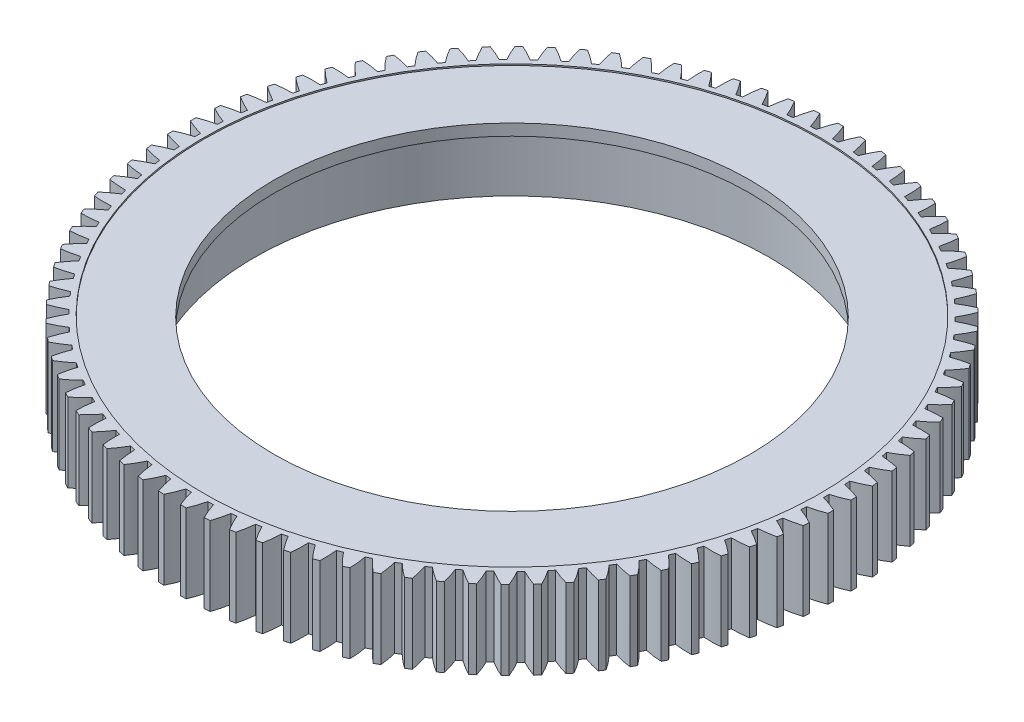
from build123d import *

# Parameters (mm, degrees)
SKETCH5_W           = 227.695
SKETCH5_H           = 54
HOLE1_D             = 332
HOLE1_CBORE_D       = 360
HOLE1_CBORE_DEPTH   = 46
SKETCH24_R          = 230
SKETCH24_R_2        = 215.126530268
BOSS_EXTRUDE1_DEPTH = 55
CUT_EXTRUDE2_DEPTH  = 330.886344064
CIRPATTERN1_COUNT   = 90


with BuildPart() as part:
    # Sketch5 → Revolve1 (revolve)
    with BuildSketch(Plane(origin=(0, 0, 0), x_dir=(-1, 0, 0), z_dir=(0, 0, -1))):
        with Locations((-113.8475, -27)):
            Rectangle(SKETCH5_W, SKETCH5_H)
    revolve(axis=Axis((0, -54, 0), (0, 1, 0)))

    # Sketch6 → Cut-Revolve1 (revolve, cut)
    with BuildSketch(Plane(origin=(0, 0, 137.885822331), x_dir=(-1, 0, 0), z_dir=(0, 0, -1))):
        Polygon((-141.209322331, -54), (-137.885822331, -54), (-137.885822331, -36), (-141.209322331, -37.996960267), (-141.209322331, -42), align=None)
    revolve(axis=Axis((137.885822331, -54, 137.885822331), (0, 1, 0)), mode=Mode.SUBTRACT)

    # Sketch7 → Cut-Revolve2 (revolve, cut)
    with BuildSketch(Plane(origin=(0, 0, 50.469713795), x_dir=(-1, 0, 0), z_dir=(0, 0, -1))):
        Polygon((-191.679036126, -54), (-188.355536126, -54), (-188.355536126, -36), (-191.679036126, -37.996960267), (-191.679036126, -42), align=None)
    revolve(axis=Axis((188.355536126, -54, 50.469713795), (0, 1, 0)), mode=Mode.SUBTRACT)

    # Sketch8 → Cut-Revolve3 (revolve, cut)
    with BuildSketch(Plane(origin=(0, 0, -50.469713795), x_dir=(-1, 0, 0), z_dir=(0, 0, -1))):
        Polygon((-191.679036126, -54), (-188.355536126, -54), (-188.355536126, -36), (-191.679036126, -37.996960267), (-191.679036126, -42), align=None)
    revolve(axis=Axis((188.355536126, -54, -50.469713795), (0, 1, 0)), mode=Mode.SUBTRACT)

    # Sketch9 → Cut-Revolve4 (revolve, cut)
    with BuildSketch(Plane(origin=(0, 0, -137.885822331), x_dir=(-1, 0, 0), z_dir=(0, 0, -1))):
        Polygon((-141.209322331, -54), (-137.885822331, -54), (-137.885822331, -36), (-141.209322331, -37.996960267), (-141.209322331, -42), align=None)
    revolve(axis=Axis((137.885822331, -54, -137.885822331), (0, 1, 0)), mode=Mode.SUBTRACT)

    # Sketch10 → Cut-Revolve5 (revolve, cut)
    with BuildSketch(Plane(origin=(0, 0, -188.355536126), x_dir=(-1, 0, 0), z_dir=(0, 0, -1))):
        Polygon((-53.793213795, -54), (-50.469713795, -54), (-50.469713795, -36), (-53.793213795, -37.996960267), (-53.793213795, -42), align=None)
    revolve(axis=Axis((50.469713795, -54, -188.355536126), (0, 1, 0)), mode=Mode.SUBTRACT)

    # Sketch11 → Cut-Revolve6 (revolve, cut)
    with BuildSketch(Plane(origin=(0, 0, -188.355536126), x_dir=(-1, 0, 0), z_dir=(0, 0, -1))):
        Polygon((47.146213795, -54), (50.469713795, -54), (50.469713795, -36), (47.146213795, -37.996960267), (47.146213795, -42), align=None)
    revolve(axis=Axis((-50.469713795, -54, -188.355536126), (0, 1, 0)), mode=Mode.SUBTRACT)

    # Sketch12 → Cut-Revolve7 (revolve, cut)
    with BuildSketch(Plane(origin=(0, 0, -137.885822331), x_dir=(-1, 0, 0), z_dir=(0, 0, -1))):
        Polygon((134.562322331, -54), (137.885822331, -54), (137.885822331, -36), (134.562322331, -37.996960267), (134.562322331, -42), align=None)
    revolve(axis=Axis((-137.885822331, -54, -137.885822331), (0, 1, 0)), mode=Mode.SUBTRACT)

    # Sketch13 → Cut-Revolve8 (revolve, cut)
    with BuildSketch(Plane(origin=(0, 0, -50.469713795), x_dir=(-1, 0, 0), z_dir=(0, 0, -1))):
        Polygon((185.032036126, -54), (188.355536126, -54), (188.355536126, -36), (185.032036126, -37.996960267), (185.032036126, -42), align=None)
    revolve(axis=Axis((-188.355536126, -54, -50.469713795), (0, 1, 0)), mode=Mode.SUBTRACT)

    # Sketch14 → Cut-Revolve9 (revolve, cut)
    with BuildSketch(Plane(origin=(0, 0, 50.469713795), x_dir=(-1, 0, 0), z_dir=(0, 0, -1))):
        Polygon((185.032036126, -54), (188.355536126, -54), (188.355536126, -36), (185.032036126, -37.996960267), (185.032036126, -42), align=None)
    revolve(axis=Axis((-188.355536126, -54, 50.469713795), (0, 1, 0)), mode=Mode.SUBTRACT)

    # Sketch15 → Cut-Revolve10 (revolve, cut)
    with BuildSketch(Plane(origin=(0, 0, 137.885822331), x_dir=(-1, 0, 0), z_dir=(0, 0, -1))):
        Polygon((134.562322331, -54), (137.885822331, -54), (137.885822331, -36), (134.562322331, -37.996960267), (134.562322331, -42), align=None)
    revolve(axis=Axis((-137.885822331, -54, 137.885822331), (0, 1, 0)), mode=Mode.SUBTRACT)

    # Sketch16 → Cut-Revolve11 (revolve, cut)
    with BuildSketch(Plane(origin=(0, 0, 188.355536126), x_dir=(-1, 0, 0), z_dir=(0, 0, -1))):
        Polygon((47.146213795, -54), (50.469713795, -54), (50.469713795, -36), (47.146213795, -37.996960267), (47.146213795, -42), align=None)
    revolve(axis=Axis((-50.469713795, -54, 188.355536126), (0, 1, 0)), mode=Mode.SUBTRACT)

    # Sketch17 → Cut-Revolve12 (revolve, cut)
    with BuildSketch(Plane(origin=(0, 0, 188.355536126), x_dir=(-1, 0, 0), z_dir=(0, 0, -1))):
        Polygon((-53.793213795, -54), (-50.469713795, -54), (-50.469713795, -36), (-53.793213795, -37.996960267), (-53.793213795, -42), align=None)
    revolve(axis=Axis((50.469713795, -54, 188.355536126), (0, 1, 0)), mode=Mode.SUBTRACT)

    # Hole1 (through all)
    with Locations(Plane(origin=(0, -54, 0), x_dir=(-1, 0, 0), z_dir=(0, -1, 0))):
        with Locations((0, 0)):
            CounterBoreHole(HOLE1_D / 2, HOLE1_CBORE_D / 2, HOLE1_CBORE_DEPTH)

    # Sketch24 → Boss-Extrude1 (add)
    with BuildSketch(Plane.XZ.offset(54)):
        Circle(SKETCH24_R)
        Circle(SKETCH24_R_2, mode=Mode.SUBTRACT)
    extrude(amount=-BOSS_EXTRUDE1_DEPTH)

    # Sketch23 → Cut-Extrude2 (cut, through all)
    with BuildSketch(Plane.XZ.offset(54)):
        with BuildLine():
            ThreePointArc((218.746088683, 1.308123098), (218.749160843, -0.605913015), (218.735485439, -2.519902738))
            add(Edge.make_bspline(
                [(218.735485439, -2.519902738), (218.843133329, -2.549803175), (219.062576288, -2.611550665), (219.489381247, -2.733636253), (219.947330154, -2.87009042), (220.48516097, -3.034296913), (221.046286799, -3.211707342), (221.816501896, -3.463012607), (222.638182825, -3.743828434), (223.47863756, -4.043422604), (224.332178634, -4.360586592), (225.043754372, -4.633148161), (225.929220025, -4.982432974), (226.986645403, -5.41524031), (228.562412759, -6.088780895), (230.641917007, -7.036192431), (232.694457605, -8.040818156), (234.72028822, -9.097942372), (236.724796851, -10.19468623), (238.535291851, -11.230736291), (239.997557573, -12.107830656), (241.122618257, -12.806237746), (241.598675598, -13.105983156)],
                knots=[0.031810333, 0.031810333, 0.031810333, 0.031810333, 0.031810333, 0.036357777, 0.040905403, 0.04545303, 0.050000656, 0.056092053, 0.06218345, 0.074366244, 0.08118792, 0.088009595, 0.09483127, 0.101652946, 0.115296199, 0.128939451, 0.156225625, 0.18351189, 0.197155146, 0.210798403, 0.23808486, 0.25823973, 0.25823973, 0.25823973, 0.25823973, 0.25823973], degree=4))
            ThreePointArc((241.598675598, -13.105983156), (241.952965878, -0.670185073), (241.667572294, 11.76738487))
            add(Edge.make_bspline(
                [(218.746088683, 1.308123098), (218.913076962, 1.353511063), (219.236869705, 1.443507176), (219.997704325, 1.659091237), (220.621599411, 1.851439071), (221.475711681, 2.116934906), (222.18629531, 2.353564352), (222.978880952, 2.622250301), (223.716983324, 2.885546455), (224.483259494, 3.165618882), (225.227727913, 3.448580938), (225.980478596, 3.742379587), (226.723644191, 4.041871694), (227.552031741, 4.384684064), (228.559014518, 4.814765248), (229.745553994, 5.340832588), (231.103990475, 5.9698128), (232.551850315, 6.670699658), (233.985621593, 7.394153041), (235.23306782, 8.049066021), (236.290168222, 8.621195364), (237.173639143, 9.111440553), (237.864319019, 9.500689287), (238.578735946, 9.911635243), (239.242625, 10.298016811), (239.985528769, 10.740296372), (240.583421102, 11.099064586), (241.221496743, 11.491034118), (241.520625668, 11.675994114), (241.667572294, 11.76738487)],
                knots=[0.052581053, 0.052581053, 0.052581053, 0.052581053, 0.052581053, 0.079962082, 0.107344057, 0.134726113, 0.162107923, 0.189489899, 0.2168719, 0.244253757, 0.271635767, 0.299017757, 0.326399581, 0.353781554, 0.381163562, 0.420995984, 0.475759838, 0.530523776, 0.585287634, 0.640051477, 0.694815386, 0.722197315, 0.749579244, 0.776961198, 0.804343153, 0.831725086, 0.85910702, 0.886488981, 0.91387022, 0.91387022, 0.91387022, 0.91387022, 0.91387022], degree=4))
        make_face()
    cut_extrude2 = extrude(amount=-CUT_EXTRUDE2_DEPTH, mode=Mode.SUBTRACT)

    # CirPattern1: Cut-Extrude2 ×90 about axis
    cirpattern1_axis = Axis((0, -54, 0), (0, -1, 0))
    for i in range(1, CIRPATTERN1_COUNT):
        add(cut_extrude2.rotate(cirpattern1_axis, i * 360 / CIRPATTERN1_COUNT), mode=Mode.SUBTRACT)


solid = part.part
